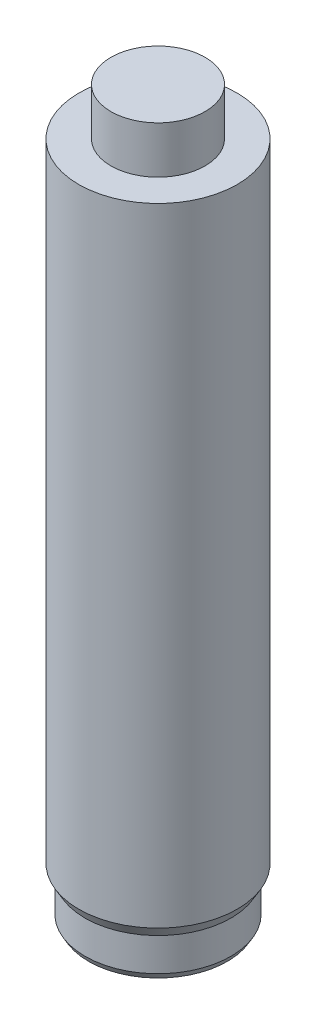
from build123d import *

# Parameters (mm, degrees)
SKETCH1_R           = 25.25
SKETCH1_R_2         = 13.45
BOSS_EXTRUDE1_DEPTH = 216
SKETCH2_OUTSIDE_W   = 98
SKETCH2_OUTSIDE_H   = 98
SKETCH2_OUTSIDE_R   = 23.25
CUT_EXTRUDE1_DEPTH  = 12
CHAMFER2_SIZE       = 4
CHAMFER2_SIZE_2     = 2.309401077
CHAMFER3_SIZE       = 2
CHAMFER3_SIZE2      = 1.154700538
SKETCH3_R           = 15
INSIDE_HEAD_DEPTH   = 15


with BuildPart() as part:
    # Sketch1 → Boss-Extrude1 (new body)
    with BuildSketch(Plane(origin=(0, 0, 0), x_dir=(1, 0, 0), z_dir=(0, 1, 0))):
        with Locations(Location((0, 0, 0), (0, 0, 270))):
            Circle(SKETCH1_R)
        with Locations(Location((0, 0, 0), (0, 0, 270))):
            Circle(SKETCH1_R_2, mode=Mode.SUBTRACT)
    extrude(amount=BOSS_EXTRUDE1_DEPTH)

    # Sketch2 outside → Cut-Extrude1 (cut)
    with BuildSketch(Plane.XZ):
        Rectangle(SKETCH2_OUTSIDE_W, SKETCH2_OUTSIDE_H)
        with Locations(Location((0, 0, 0), (0, 0, 270))):
            Circle(SKETCH2_OUTSIDE_R, mode=Mode.SUBTRACT)
    extrude(amount=-CUT_EXTRUDE1_DEPTH, mode=Mode.SUBTRACT)

    # Chamfer2
    # the kernel refuses this chamfer: 4, 2.309401077 mm, written as the material it takes off along each edge
    with BuildSketch(Plane(origin=(0, 12, 0), x_dir=(0, 0, 1), z_dir=(1, 0, 0))) as chamfer2_piece_1_section:
        Polygon((25.25, -CHAMFER2_SIZE), (25.25 - CHAMFER2_SIZE_2, 0), (25.25, 0), align=None)
    chamfer2_piece_1 = revolve(axis=Axis((0, 12, 0), (0, -1, 0)), mode=Mode.PRIVATE)
    chamfer2_piece_1 = chamfer2_piece_1 - Plane(origin=(0, 14.291094123, 0), x_dir=(0, 0, -1), z_dir=(0, -1, 0)) * Cylinder(23.25, 101, mode=Mode.PRIVATE)
    add(chamfer2_piece_1, mode=Mode.SUBTRACT)

    # Chamfer3
    chamfer3_edges = [part.edges().sort_by_distance(p)[0] for p in [
        (0, 0, 23.25),
    ]]
    chamfer3_side = [part.faces().sort_by_distance(p)[0] for p in [
        (0, 6.267949193, 23.25),
    ]]
    chamfer(chamfer3_edges, length=CHAMFER3_SIZE, length2=CHAMFER3_SIZE2, reference=chamfer3_side[0])

    # Sketch3 → inside_head (add)
    with BuildSketch(Plane(origin=(0, 216, 0), x_dir=(1, 0, 0), z_dir=(0, 1, 0))):
        with Locations(Location((0, 0, 0), (0, 0, 270))):
            Circle(SKETCH3_R)
    extrude(amount=INSIDE_HEAD_DEPTH)


solid = part.part
